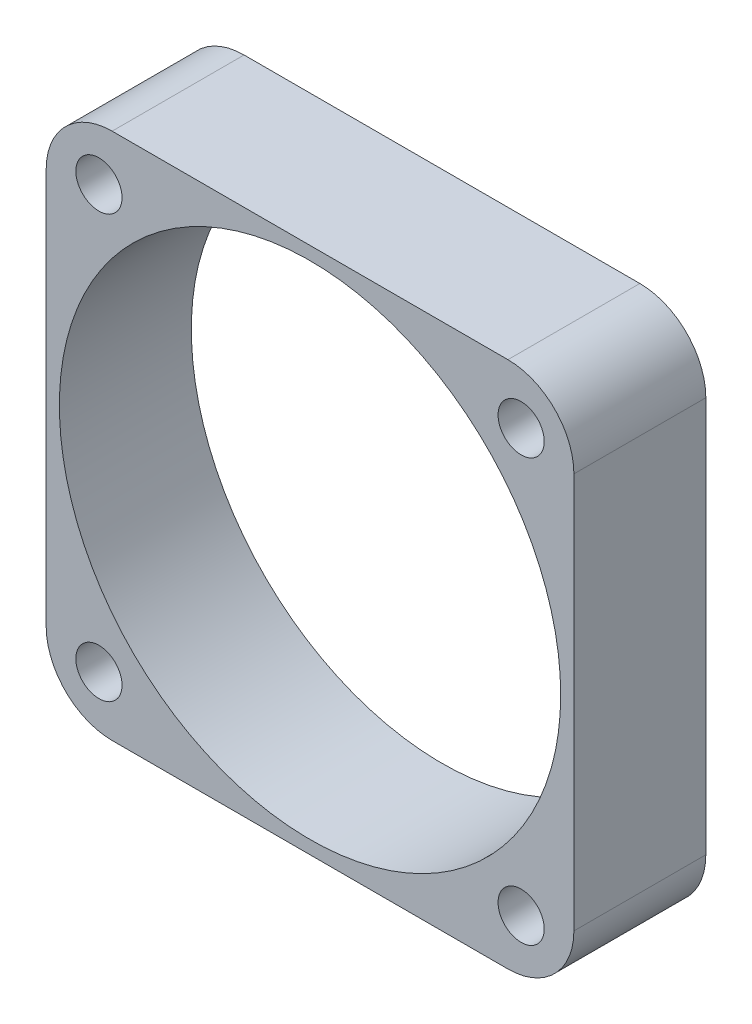
from build123d import *

# Parameters (mm, degrees)
SKETCH1_W           = 40
SKETCH1_H           = 40
BOSS_EXTRUDE1_DEPTH = 10
SKETCH3_R           = 19
SKETCH3_R_2         = 1.75
CUT_EXTRUDE1_DEPTH  = 10
FILLET1_R           = 5


with BuildPart() as part:
    # Sketch1 → Boss-Extrude1 (new body)
    with BuildSketch(Plane.XY):
        with Locations((20, 20)):
            Rectangle(SKETCH1_W, SKETCH1_H)
    extrude(amount=BOSS_EXTRUDE1_DEPTH)

    # Sketch3 → Cut-Extrude1 (cut)
    with BuildSketch(Plane.XY.offset(10)):
        with Locations((20, 20)):
            Circle(SKETCH3_R)
        with Locations((4, 36)):
            Circle(SKETCH3_R_2)
        with Locations((36, 36)):
            Circle(SKETCH3_R_2)
        with Locations((36, 4)):
            Circle(SKETCH3_R_2)
        with Locations((4, 4)):
            Circle(SKETCH3_R_2)
    extrude(amount=-CUT_EXTRUDE1_DEPTH, mode=Mode.SUBTRACT)

    # Fillet1
    fillet1_edges = [part.edges().sort_by_distance(p)[0] for p in [
        (0, 0, 5),
        (40, 0, 5),
        (0, 40, 5),
        (40, 40, 5),
    ]]
    fillet(fillet1_edges, radius=FILLET1_R)


solid = part.part
